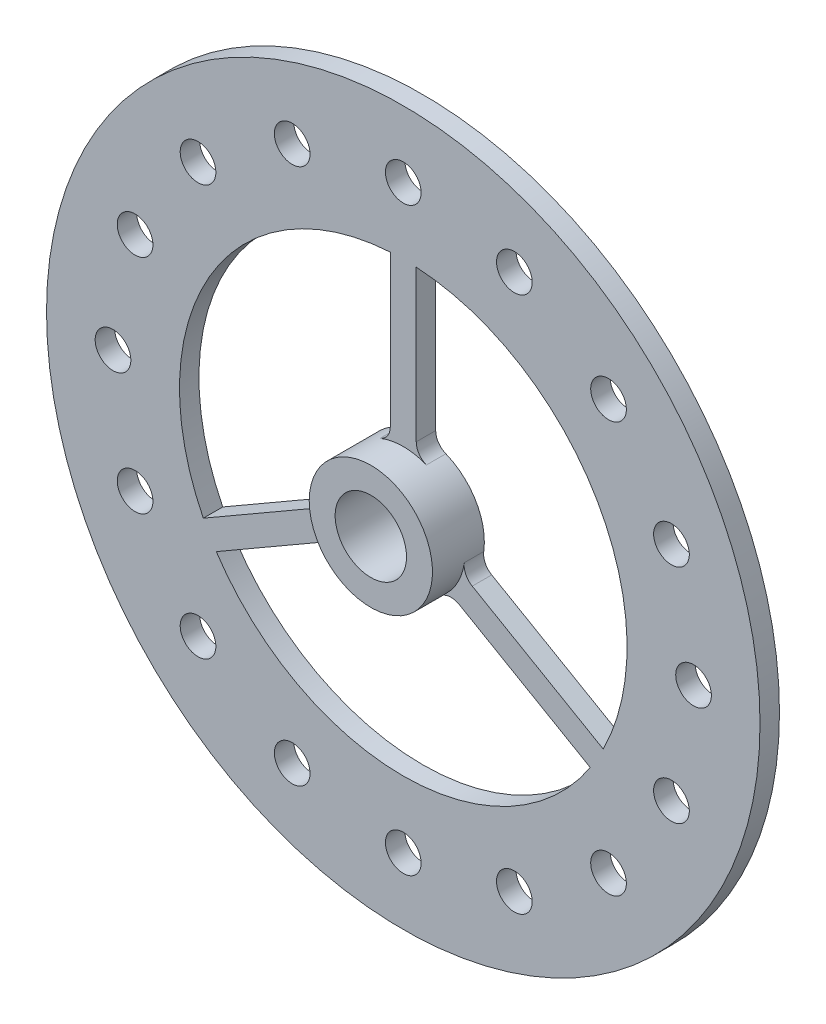
from build123d import *

# Parameters (mm, degrees)
FILLET1_R               = 0.5
CUT_EXTRUDE1_DEPTH      = 78.97595784
CIRPATTERN1_COUNT       = 3
CUT_EXTRUDE2_DEPTH      = 78.975957833
CUT_EXTRUDE2_DEPTH_BACK = 78.975957833
SKETCH3_R               = 3
BOSS_EXTRUDE1_DEPTH     = 1.5
CUT_EXTRUDE3_DEPTH      = 78.839578622
CUT_EXTRUDE3_DEPTH_BACK = 78.839578622
SKETCH6_R               = 2.75
SKETCH7_R               = 9.5
SKETCH7_R_2             = 3
BOSS_EXTRUDE2_DEPTH     = 5
CUT_EXTRUDE5_DEPTH      = 78.942286341
CUT_EXTRUDE5_DEPTH_BACK = 78.942286341
SKETCH9_R               = 5.5


# Read off the part's stored shape, not the designer's step: Split1, Split2
with BuildPart() as part:
    # Sketch1 → Revolve1 (revolve)
    with BuildSketch(Plane(origin=(0, 0, 0), x_dir=(0, 0, -1), z_dir=(1, 0, 0)), mode=Mode.PRIVATE) as revolve1_sk:
        Polygon((-4, 55), (4, 55), (4, 50), (1.5, 50), (1.5, 0), (-1.5, 0), (-1.5, 50), (-4, 50), align=None)
    revolve(revolve1_sk.sketch.rotate(Axis((0, 0, 1.5), (0, 0, -1)), 90), axis=Axis((0, 0, 1.5), (0, 0, -1)))

    # Fillet1
    fillet1_edges = [part.edges().sort_by_distance(p)[0] for p in [
        (-50, 0, -1.5),
        (-50, 0, -4),
        (-55, 0, -4),
        (-55, 0, 4),
        (-50, 0, 4),
        (-50, 0, 1.5),
    ]]
    fillet(fillet1_edges, radius=FILLET1_R)

    # Sketch2 → Cut-Extrude1 (cut, symmetric)
    with BuildSketch(Plane(origin=(0, 0, -1.5), x_dir=(-1, 0, 0), z_dir=(0, 0, -1))):
        with BuildLine():
            Line((10.633924434, -3.830098058), (41.516200464, -21.659988437))
            ThreePointArc((41.516200464, -21.659988437), (43.528240329, -21.875953118), (45.040998361, -20.531889019))
            ThreePointArc((45.040998361, -20.531889019), (42.868257487, 24.75), (4.739361702, 49.272593302))
            ThreePointArc((4.739361702, 49.272593302), (2.818989033, 48.634538466), (2, 46.784078488))
            Line((2, 46.784078488), (2, 11.124297731))
            ThreePointArc((2, 11.124297731), (2.427109506, 9.726755245), (3.5625, 8.806735703))
            ThreePointArc((3.5625, 8.806735703), (8.227241336, 4.75), (9.408106844, -1.318152351))
            ThreePointArc((9.408106844, -1.318152351), (9.637171891, -2.761439132), (10.633924434, -3.830098058))
        make_face()
    cut_extrude1 = extrude(amount=CUT_EXTRUDE1_DEPTH, both=True, mode=Mode.SUBTRACT)

    # CirPattern1: Cut-Extrude1 ×3 about axis
    cirpattern1_axis = Axis((0, 0, 0), (0, 0, 1))
    for i in range(1, CIRPATTERN1_COUNT):
        add(cut_extrude1.rotate(cirpattern1_axis, i * 360 / CIRPATTERN1_COUNT), mode=Mode.SUBTRACT)

    # Sketch3 → Cut-Extrude2 (cut, two sides: drawn at the far end of the back side and taken through both)
    with BuildSketch(Plane.XY.offset(1.5).offset(-CUT_EXTRUDE2_DEPTH_BACK)):
        Circle(SKETCH3_R)
    extrude(amount=CUT_EXTRUDE2_DEPTH + CUT_EXTRUDE2_DEPTH_BACK, mode=Mode.SUBTRACT)

    # Sketch4 → Boss-Extrude1 (add, symmetric)
    with BuildSketch(Plane.XY):
        with BuildLine():
            Line((-2, 46.784078488), (-2, 34.441980199))
            ThreePointArc((-2, 34.441980199), (-29.877876431, 17.25), (-30.827629809, -15.488939292))
            Line((-30.827629809, -15.488939292), (-41.516200464, -21.659988437))
            ThreePointArc((-41.516200464, -21.659988437), (-43.528240329, -21.875953118), (-45.040998361, -20.531889019))
            ThreePointArc((-45.040998361, -20.531889019), (-42.868257487, 24.75), (-4.739361702, 49.272593302))
            ThreePointArc((-4.739361702, 49.272593302), (-2.818989033, 48.634538466), (-2, 46.784078488))
        make_face()
        with BuildLine():
            Line((2, 34.441980199), (2, 46.784078488))
            ThreePointArc((2, 46.784078488), (2.818989033, 48.634538466), (4.739361702, 49.272593302))
            ThreePointArc((4.739361702, 49.272593302), (42.868257487, 24.75), (45.040998361, -20.531889019))
            ThreePointArc((45.040998361, -20.531889019), (43.528240329, -21.875953118), (41.516200464, -21.659988437))
            Line((41.516200464, -21.659988437), (30.827629809, -15.488939292))
            ThreePointArc((30.827629809, -15.488939292), (29.877876431, 17.25), (2, 34.441980199))
        make_face()
        with BuildLine():
            Line((28.827629809, -18.953040907), (39.516200464, -25.124090052))
            ThreePointArc((39.516200464, -25.124090052), (40.709251296, -26.758585348), (40.301636658, -28.740704283))
            ThreePointArc((40.301636658, -28.740704283), (0, -49.5), (-40.301636658, -28.740704283))
            ThreePointArc((-40.301636658, -28.740704283), (-40.709251296, -26.758585348), (-39.516200464, -25.124090052))
            Line((-39.516200464, -25.124090052), (-28.827629809, -18.953040907))
            ThreePointArc((-28.827629809, -18.953040907), (0, -34.5), (28.827629809, -18.953040907))
        make_face()
    extrude(amount=BOSS_EXTRUDE1_DEPTH, both=True)


with BuildPart() as body_2:
    # Split1: the piece on the far side of the plane
    add(part.part)
    split(bisect_by=Plane.XY.offset(1.5), keep=Keep.BOTTOM)


with BuildPart() as part_1:
    add(part.part)

    # Split1
    split(bisect_by=Plane.XY.offset(1.5), keep=Keep.TOP)


with BuildPart() as body_3:
    # Split2: the piece on the far side of the plane
    add(body_2.part)
    split(bisect_by=Plane.XY.offset(-1.5), keep=Keep.BOTTOM)


with BuildPart() as body_2_1:
    add(body_2.part)

    # Split2
    split(bisect_by=Plane.XY.offset(-1.5), keep=Keep.TOP)

    # Sketch6 → Cut-Extrude3 (cut, two sides: drawn at the far end of the back side and taken through both)
    with BuildSketch(Plane(origin=(0, 0, -1.5), x_dir=(-1, 0, 0), z_dir=(0, 0, -1)).offset(-CUT_EXTRUDE3_DEPTH_BACK)):
        with Locations((-44.75, 0)):
            Circle(SKETCH6_R)
        with Locations((-41.34360908, 17.125083598)):
            Circle(SKETCH6_R)
        with Locations((-31.643028458, 31.643028458)):
            Circle(SKETCH6_R)
        with Locations((-17.125083598, 41.34360908)):
            Circle(SKETCH6_R)
        with Locations((0, 44.75)):
            Circle(SKETCH6_R)
        with Locations((17.125083598, 41.34360908)):
            Circle(SKETCH6_R)
        with Locations((31.643028458, 31.643028458)):
            Circle(SKETCH6_R)
        with Locations((41.34360908, 17.125083598)):
            Circle(SKETCH6_R)
        with Locations((44.75, 0)):
            Circle(SKETCH6_R)
        with Locations((41.34360908, -17.125083598)):
            Circle(SKETCH6_R)
        with Locations((31.643028458, -31.643028458)):
            Circle(SKETCH6_R)
        with Locations((17.125083598, -41.34360908)):
            Circle(SKETCH6_R)
        with Locations((0, -44.75)):
            Circle(SKETCH6_R)
        with Locations((-17.125083598, -41.34360908)):
            Circle(SKETCH6_R)
        with Locations((-31.643028458, -31.643028458)):
            Circle(SKETCH6_R)
        with Locations((-41.34360908, -17.125083598)):
            Circle(SKETCH6_R)
    extrude(amount=CUT_EXTRUDE3_DEPTH + CUT_EXTRUDE3_DEPTH_BACK, mode=Mode.SUBTRACT)

    # Sketch7 → Boss-Extrude2 (add)
    with BuildSketch(Plane.XY.offset(1.5)):
        with Locations(Location((0, 0, 0), (0, 0, 180))):
            Circle(SKETCH7_R)
        Circle(SKETCH7_R_2, mode=Mode.SUBTRACT)
    extrude(amount=BOSS_EXTRUDE2_DEPTH)

    # Sketch9 → Cut-Extrude5 (cut, two sides: drawn at the far end of the back side and taken through both)
    with BuildSketch(Plane.XY.offset(1.5).offset(-CUT_EXTRUDE5_DEPTH_BACK)):
        Circle(SKETCH9_R)
    extrude(amount=CUT_EXTRUDE5_DEPTH + CUT_EXTRUDE5_DEPTH_BACK, mode=Mode.SUBTRACT)


solid = body_2_1.part
